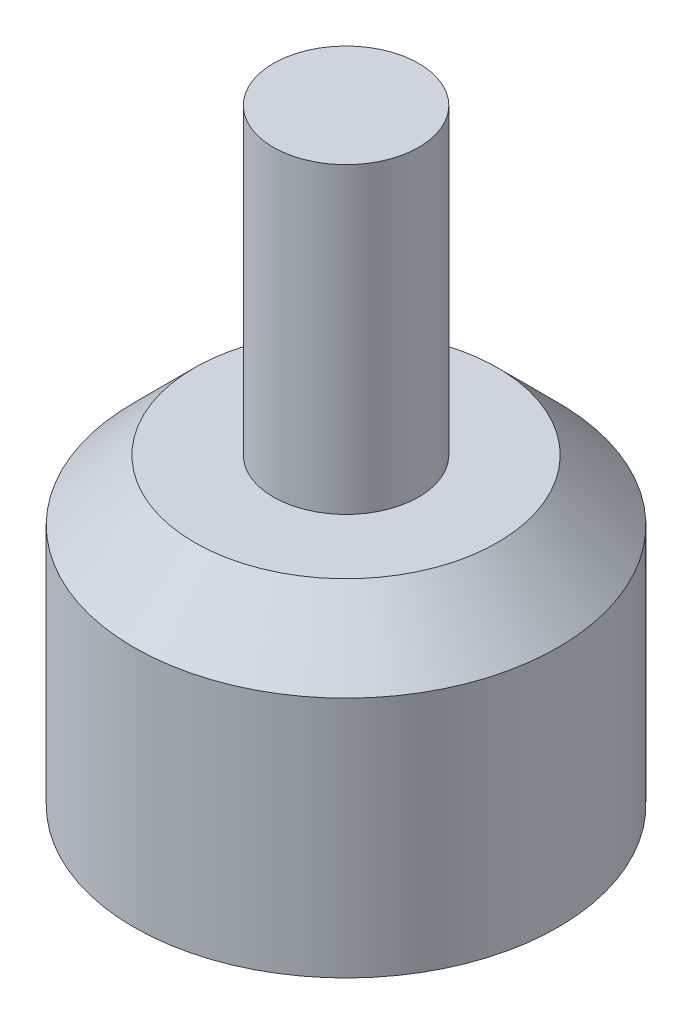
from build123d import *

# Parameters (mm, degrees)
SKETCH1_R           = 7
BOSS_EXTRUDE1_DEPTH = 10
CHAMFER1_SIZE       = 2
SKETCH2_R           = 2.4
BOSS_EXTRUDE2_DEPTH = 10


with BuildPart() as part:
    # Sketch1 → Boss-Extrude1 (new body)
    with BuildSketch(Plane(origin=(0, 0, 0), x_dir=(1, 0, 0), z_dir=(0, 1, 0))):
        Circle(SKETCH1_R)
    extrude(amount=BOSS_EXTRUDE1_DEPTH)

    # Chamfer1
    chamfer1_edges = [part.edges().sort_by_distance(p)[0] for p in [
        (-7, 10, 0),
    ]]
    chamfer(chamfer1_edges, length=CHAMFER1_SIZE)

    # Sketch2 → Boss-Extrude2 (add)
    with BuildSketch(Plane(origin=(0, 10, 0), x_dir=(1, 0, 0), z_dir=(0, 1, 0))):
        Circle(SKETCH2_R)
    extrude(amount=BOSS_EXTRUDE2_DEPTH)


solid = part.part
